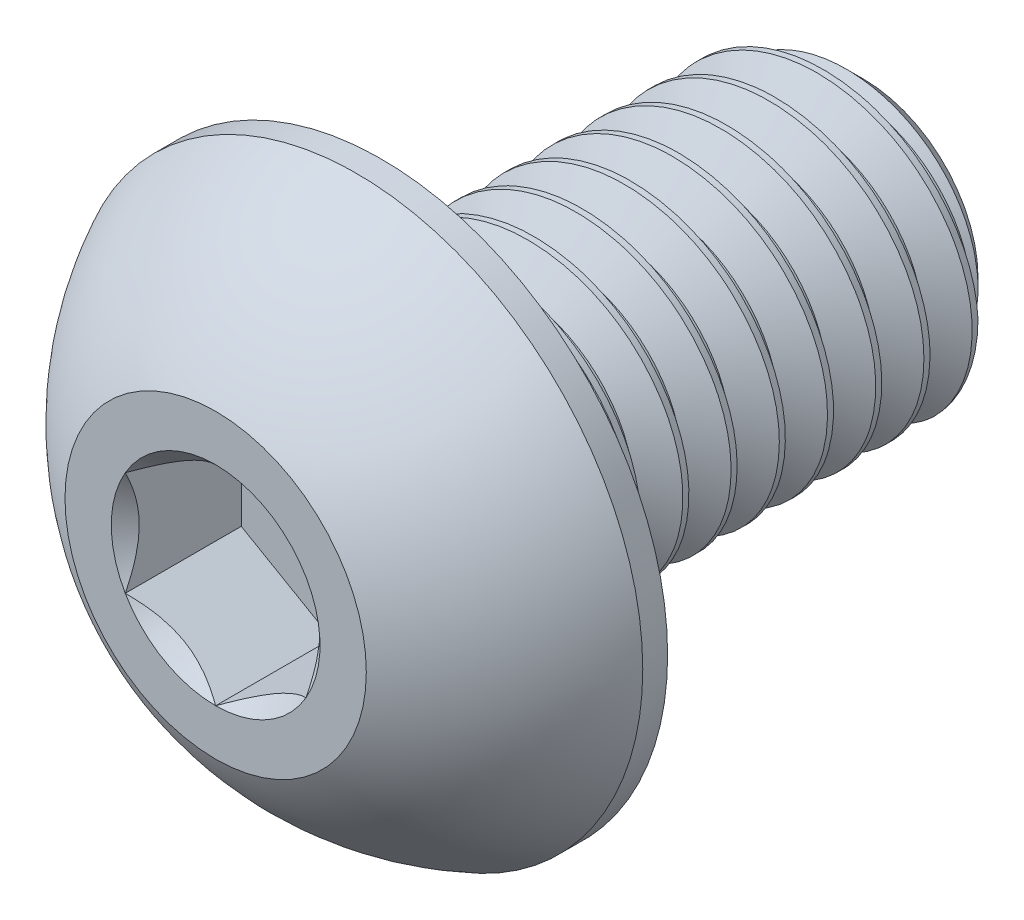
from build123d import *

# Parameters (mm, degrees)
CUT_EXTRUDE2_DEPTH = 1.925
CUT_SWEEP2_PITCH   = 0.8
CUT_SWEEP2_TO      = 8


with BuildPart() as part:
    # Sketch10 → Revolve3 (revolve)
    with BuildSketch(Plane(origin=(0, 0, 0), x_dir=(0, 0, -1), z_dir=(1, 0, 0)), mode=Mode.PRIVATE) as revolve3_sk:
        Polygon((10.15, 2.5), (10.75, 1.9), (10.75, 0), (2.75, 0), (2.75, 2.5), align=None)
    revolve(revolve3_sk.sketch.rotate(Axis((0, 0, 0), (0, 0, -1)), 90), axis=Axis((0, 0, 0), (0, 0, -1)))

    # Sketch7 → Revolve2 (revolve)
    with BuildSketch(Plane(origin=(0, 0, 0), x_dir=(0, 0, -1), z_dir=(1, 0, 0)), mode=Mode.PRIVATE) as revolve2_sk:
        with BuildLine():
            Line((2.3375, 4.75), (2.75, 4.75))
            Line((2.75, 4.75), (2.75, 0))
            Line((2.75, 0), (0, 0))
            Line((0, 0), (0, 2.5))
            ThreePointArc((0, 2.5), (0.991875183, 3.808753282), (2.3375, 4.75))
        make_face()
    revolve(revolve2_sk.sketch.rotate(Axis((0, 0, 0), (0, 0, -1)), 180), axis=Axis((0, 0, 0), (0, 0, -1)))

    # Sketch5 → Cut-Extrude2 (cut)
    with BuildSketch(Plane.XY):
        Polygon((1.5, -0.866025404), (1.5, 0.866025404), (0, 1.732050808), (-1.5, 0.866025404), (-1.5, -0.866025404), (0, -1.732050808), align=None)
    extrude(amount=-CUT_EXTRUDE2_DEPTH, mode=Mode.SUBTRACT)

    # Cut-Extrude3 cone 1 section (through the dimple's axis) → Cut-Extrude3 (revolve, cut)
    with BuildSketch(Plane(origin=(0, 0, 0), x_dir=(0, -1, 0), z_dir=(1, 0, 0))):
        Polygon((0, 0), (1.732050808, 0), (0, 1.732050808), align=None)
    revolve(axis=Axis((0, 0, 0), (0, 0, -1)), mode=Mode.SUBTRACT)


with BuildPart() as body_2:
    # Split1: read off the stored shape, not the designer's step
    # Split1: the piece on the far side of the plane
    add(part.part)
    split(bisect_by=Plane.XY.offset(-2.75), keep=Keep.BOTTOM)

    # Cut-Sweep2: arcs per turn and ends read off the stored shape
    # Cut-Sweep2: the profile of Sketch12 screwed along a right-hand helix through 15 turns, 8 arcs to a turn; built about Z, then put on its axis
    cut_sweep2_z = Axis((0, 0, 0), (0, 0, 1))
    cut_sweep2_corners = [(1.980384758, 0, -0.3), (1.980384758, 0, -0.4), (2.54330127, 0, -0.725), (2.54330127, 0, 0.025)]
    with BuildLine(mode=Mode.PRIVATE) as cut_sweep2_profile:
        Line(cut_sweep2_corners[0], cut_sweep2_corners[1])
        Line(cut_sweep2_corners[1], cut_sweep2_corners[2])
        Line(cut_sweep2_corners[2], cut_sweep2_corners[3])
        Line(cut_sweep2_corners[3], cut_sweep2_corners[0])
    cut_sweep2_cap = Face(cut_sweep2_profile.wire())
    cut_sweep2_turn_angles = [0, 22.5, 45, 67.5, 90, 112.5, 135, 157.5, 180, 202.5, 225, 247.5, 270, 292.5, 315, 337.5, 360]
    cut_sweep2_turn_weights = [1, 0.9238795325112867, 1, 0.9238795325112867, 1, 0.9238795325112867, 1, 0.9238795325112867, 1, 0.9238795325112867, 1, 0.9238795325112867, 1, 0.9238795325112867, 1, 0.9238795325112867, 1]
    cut_sweep2_turn_rails = [Edge.make_bspline([Vector(p[0], p[1], 0).rotate(cut_sweep2_z, cut_sweep2_turn_angles[k]) / cut_sweep2_turn_weights[k] + Vector(0, 0, p[2] + CUT_SWEEP2_PITCH * cut_sweep2_turn_angles[k] / 360) for k in range(17)], [0, 0, 0, 1, 1, 2, 2, 3, 3, 4, 4, 5, 5, 6, 6, 7, 7, 8, 8, 8], 2, cut_sweep2_turn_weights) for p in cut_sweep2_corners]
    cut_sweep2_turn_sides = [Face.make_surface_from_curves(cut_sweep2_turn_rails[p[0]], cut_sweep2_turn_rails[p[1]]) for p in [(0, 1), (1, 2), (2, 3), (3, 0)]]
    cut_sweep2 = Plane(origin=(0, 0, -10.75), x_dir=(0, 1, 0), z_dir=(0, 0, 1)) * split(Solid(Shell([*[p.moved(Location((0, 0, CUT_SWEEP2_PITCH * i))) for i in range(15) for p in cut_sweep2_turn_sides], cut_sweep2_cap, cut_sweep2_cap.rotate(cut_sweep2_z, 5400).moved(Location((0, 0, CUT_SWEEP2_PITCH * 5400 / 360)))])), bisect_by=Plane.XY.offset(CUT_SWEEP2_TO), keep=Keep.BOTTOM, mode=Mode.PRIVATE)
    add(cut_sweep2, mode=Mode.SUBTRACT)


with BuildPart() as part_1:
    add(part.part)

    # Split1
    split(bisect_by=Plane.XY.offset(-2.75), keep=Keep.TOP)

    add(body_2.part)  # Boss-Extrude1 merges body 2
    # Boss-Extrude1: read off the stored shape, not the designer's step
    # Boss-Extrude1 outline → Boss-Extrude1 (revolve)
    with BuildSketch(Plane.XZ):
        Polygon((1.980384758, -2.75), (1.980384758, -3.269615242), (2.5, -2.75), align=None)
    revolve(axis=Axis((0, 0, 0), (0, 0, 1)))


solid = part_1.part
